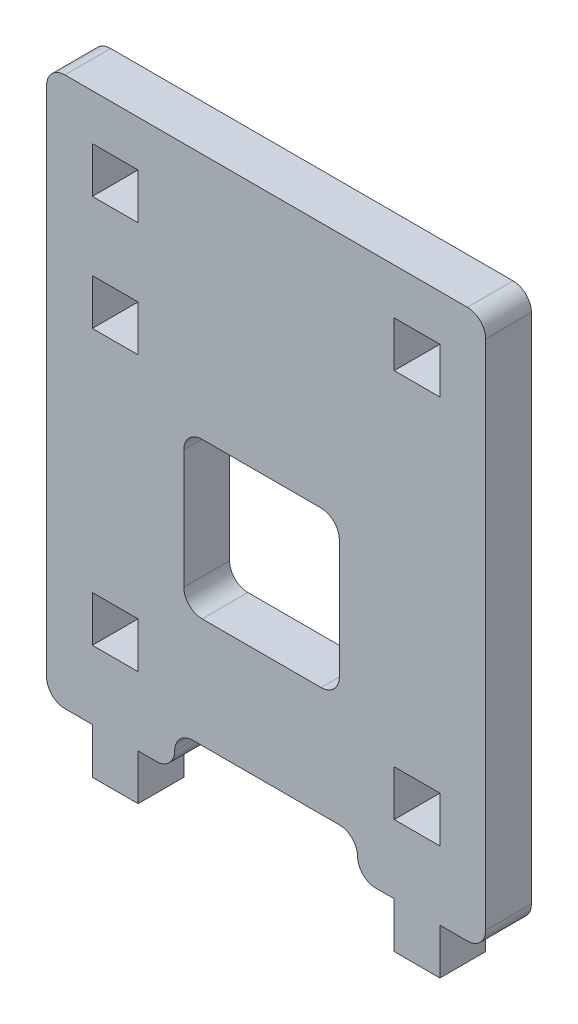
from build123d import *

# Parameters (mm, degrees)
ESQUISSE1_W        = 5
ESQUISSE1_H        = 5
ESQUISSE1_W_2      = 17
ESQUISSE1_H_2      = 17
BOSS_EXTRU_1_DEPTH = 5
CONG_1_START       = -1
CONG_1_DEPTH       = 7
CONG_1_2_DEPTH     = 5


with BuildPart() as part:
    # Esquisse1 → Boss.-Extru.1 (new body)
    with BuildSketch(Plane.XY):
        Polygon((0, 0), (5, 0), (5, -5), (10, -5), (10, 0), (14, 0), (14, 4), (34, 4), (34, 0), (38, 0), (38, -5), (43, -5), (43, 0), (48, 0), (48, 60), (0, 60), align=None)
        with Locations((7.5, 10)):
            Rectangle(ESQUISSE1_W, ESQUISSE1_H, mode=Mode.SUBTRACT)
        with Locations((7.5, 40)):
            Rectangle(ESQUISSE1_W, ESQUISSE1_H, mode=Mode.SUBTRACT)
        with Locations((40.5, 10)):
            Rectangle(ESQUISSE1_W, ESQUISSE1_H, mode=Mode.SUBTRACT)
        with Locations((40.5, 52.5)):
            Rectangle(ESQUISSE1_W, ESQUISSE1_H, mode=Mode.SUBTRACT)
        with Locations((7.5, 52.5)):
            Rectangle(ESQUISSE1_W, ESQUISSE1_H, mode=Mode.SUBTRACT)
        with Locations((23.5, 24.5)):
            Rectangle(ESQUISSE1_W_2, ESQUISSE1_H_2, mode=Mode.SUBTRACT)
    extrude(amount=BOSS_EXTRU_1_DEPTH)

    # Congé1: read off the stored shape, not the designer's step
    # Congé1 outline → Congé1 (cut)
    with BuildSketch(Plane.XY.offset(CONG_1_START)):
        with BuildLine():
            Line((14, 0), (14, 2))
            ThreePointArc((14, 2), (13.414213562, 0.585786438), (12, 0))
            Line((12, 0), (14, 0))
        make_face()
        with BuildLine():
            ThreePointArc((36, 0), (34.585786438, 0.585786438), (34, 2))
            Line((34, 2), (34, 0))
            Line((34, 0), (36, 0))
        make_face()
        with BuildLine():
            Line((48, 0), (48, 2))
            ThreePointArc((48, 2), (47.414213562, 0.585786438), (46, 0))
            Line((46, 0), (48, 0))
        make_face()
        with BuildLine():
            ThreePointArc((2, 0), (0.585786438, 0.585786438), (0, 2))
            Line((0, 2), (0, 0))
            Line((0, 0), (2, 0))
        make_face()
        with BuildLine():
            ThreePointArc((0, 58), (0.585786438, 59.414213562), (2, 60))
            Line((2, 60), (0, 60))
            Line((0, 60), (0, 58))
        make_face()
        with BuildLine():
            ThreePointArc((46, 60), (47.414213562, 59.414213562), (48, 58))
            Line((48, 58), (48, 60))
            Line((48, 60), (46, 60))
        make_face()
    extrude(amount=CONG_1_DEPTH, mode=Mode.SUBTRACT)

    # Cong_1 2 outline → Cong_1 2 (add)
    with BuildSketch(Plane.XY):
        with BuildLine():
            ThreePointArc((30, 33), (31.414213562, 32.414213562), (32, 31))
            Line((32, 31), (32, 33))
            Line((32, 33), (30, 33))
        make_face()
        with BuildLine():
            Line((32, 16), (32, 18))
            ThreePointArc((32, 18), (31.414213562, 16.585786438), (30, 16))
            Line((30, 16), (32, 16))
        make_face()
        with BuildLine():
            ThreePointArc((15, 31), (15.585786438, 32.414213562), (17, 33))
            Line((17, 33), (15, 33))
            Line((15, 33), (15, 31))
        make_face()
        with BuildLine():
            Line((15, 16), (17, 16))
            ThreePointArc((17, 16), (15.585786438, 16.585786438), (15, 18))
            Line((15, 18), (15, 16))
        make_face()
        with BuildLine():
            Line((34, 4), (32, 4))
            ThreePointArc((32, 4), (33.414213562, 3.414213562), (34, 2))
            Line((34, 2), (34, 4))
        make_face()
        with BuildLine():
            ThreePointArc((14, 2), (14.585786438, 3.414213562), (16, 4))
            Line((16, 4), (14, 4))
            Line((14, 4), (14, 2))
        make_face()
    extrude(amount=CONG_1_2_DEPTH)


solid = part.part
